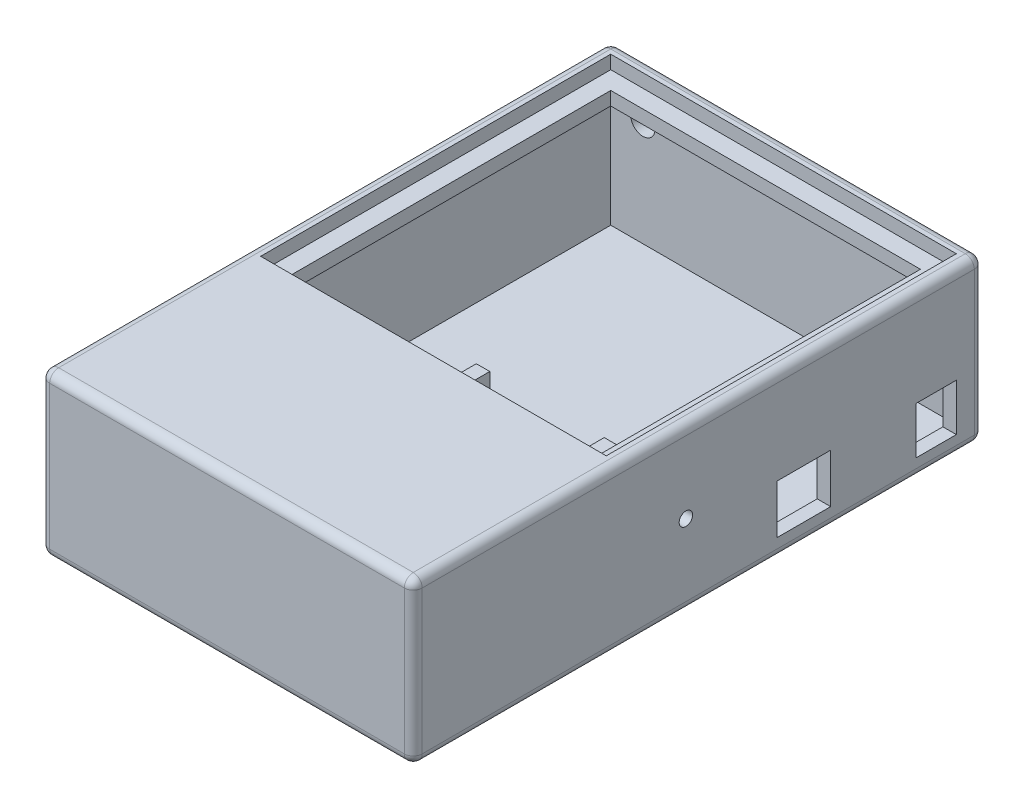
from build123d import *

# Parameters (mm, degrees)
SKETCH_1_W                = 83
SKETCH_1_H                = 127
EXTRUDE_1_DEPTH           = 36
SKETCH_2_W                = 77
SKETCH_2_H                = 40.7
CUT_EXTRUDE_1_DEPTH       = 22.9
SKETCH_3_W                = 77
SKETCH_3_H                = 78
CUT_EXTRUDE_4_DEPTH       = 33
SKETCH_4_W                = 31.5
SKETCH_4_H                = 25.3
EXTRUDE_2_DEPTH           = 11
SKETCH_5_W                = 25.5
SKETCH_5_H                = 23.3
CUT_EXTRUDE_5_DEPTH       = 11
CUT_EXTRUDE_6_DEPTH       = 14
CUT_EXTRUDE_6_DEPTH_BACK  = 10
SKETCH_6_R                = 1.5
SKETCH_7_R                = 2.5
CUT_EXTRUDE_7_DEPTH       = 22
CUT_EXTRUDE_8_DEPTH       = 23
CUT_EXTRUDE_8_DEPTH_BACK  = 30
SKETCH_8_R                = 2.7
CUT_EXTRUDE_9_DEPTH       = 11
CUT_EXTRUDE_9_DEPTH_BACK  = 33
SKETCH_9_W                = 12
SKETCH_9_H                = 10.9
CUT_EXTRUDE_10_DEPTH      = 14
CUT_EXTRUDE_10_DEPTH_BACK = 36
SKETCH_10_W               = 9
SKETCH_10_H               = 10.5
SKETCH_11_W               = 78
SKETCH_11_H               = 3
EXTRUDE_3_DEPTH           = 4
SKETCH_12_W               = 69
SKETCH_12_H               = 3
EXTRUDE_4_DEPTH           = 4
SKETCH_13_W               = 78
SKETCH_13_H               = 3
EXTRUDE_5_DEPTH           = 4
SKETCH_15_W               = 69
SKETCH_15_H               = 3
EXTRUDE_6_DEPTH           = 2
SKETCH_16_W               = 1.5
SKETCH_16_H               = 41.5
CUT_EXTRUDE_11_DEPTH      = 2
SKETCH_17_W               = 78.5
SKETCH_17_H               = 1.5
CUT_EXTRUDE_12_DEPTH      = 2
SKETCH_19_W               = 1.5
SKETCH_19_H               = 42.211102857
CUT_EXTRUDE_13_DEPTH      = 2
FILLET_1_R                = 2
FILLET_2_R                = 2
FILLET_3_R                = 2
FILLET_4_R                = 2
FILLET_5_R                = 2
SKETCH_20_W               = 8
SKETCH_20_H               = 10
CUT_EXTRUDE_14_DEPTH      = 2
SKETCH_21_W               = 8
SKETCH_21_H               = 10
CUT_EXTRUDE_15_DEPTH      = 2
CUT_EXTRUDE_16_DEPTH      = 102
CUT_EXTRUDE_16_DEPTH_BACK = 85
SKETCH_22_R               = 1.5
CUT_EXTRUDE_17_DEPTH      = 37
CUT_EXTRUDE_17_DEPTH_BACK = 68
SKETCH_23_R               = 1.5


with BuildPart() as part:
    # Эскиз1 → Бобышка-Вытянуть1 (new body)
    with BuildSketch(Plane(origin=(0, 0, 0), x_dir=(1, 0, 0), z_dir=(0, 1, 0))):
        with Locations((-41.5, 63.5)):
            Rectangle(SKETCH_1_W, SKETCH_1_H)
    extrude(amount=EXTRUDE_1_DEPTH)

    # Эскиз2 → Вырез-Вытянуть1 (cut)
    with BuildSketch(Plane(origin=(0, 0, 0), x_dir=(-1, 0, 0), z_dir=(0, -1, 0))):
        with Locations((41.5, 23.35)):
            Rectangle(SKETCH_2_W, SKETCH_2_H)
    extrude(amount=-CUT_EXTRUDE_1_DEPTH, mode=Mode.SUBTRACT)

    # Эскиз3 → Вырез-Вытянуть4 (cut)
    with BuildSketch(Plane(origin=(0, 36, 0), x_dir=(1, 0, 0), z_dir=(0, 1, 0))):
        with Locations((-41.5, 85)):
            Rectangle(SKETCH_3_W, SKETCH_3_H)
    extrude(amount=-CUT_EXTRUDE_4_DEPTH, mode=Mode.SUBTRACT)

    # Эскиз4 → Бобышка-Вытянуть2 (add)
    with BuildSketch(Plane(origin=(0, 3, 0), x_dir=(1, 0, 0), z_dir=(0, 1, 0))):
        with Locations((-41.5, 58.65)):
            Rectangle(SKETCH_4_W, SKETCH_4_H)
    extrude(amount=EXTRUDE_2_DEPTH)

    # Эскиз5 → Вырез-Вытянуть5 (cut)
    with BuildSketch(Plane(origin=(0, 14, 0), x_dir=(1, 0, 0), z_dir=(0, 1, 0))):
        with Locations((-41.5, 59.65)):
            Rectangle(SKETCH_5_W, SKETCH_5_H)
    extrude(amount=-CUT_EXTRUDE_5_DEPTH, mode=Mode.SUBTRACT)

    # Эскиз6 → Вырез-Вытянуть6 (cut, two sides: drawn at the far end of the back side and taken through both)
    with BuildSketch(Plane(origin=(0, 0, 0), x_dir=(0, 0, -1), z_dir=(1, 0, 0)).offset(-CUT_EXTRUDE_6_DEPTH_BACK)):
        with Locations(Location((60.742856383, 18, 0), (0, 0, 180))):
            Circle(SKETCH_6_R)
    extrude(amount=CUT_EXTRUDE_6_DEPTH + CUT_EXTRUDE_6_DEPTH_BACK, mode=Mode.SUBTRACT)

    # Эскиз7 → Вырез-Вытянуть7 (cut)
    with BuildSketch(Plane.XY.offset(-43.7)):
        with Locations((-5.5, 19.4)):
            Circle(SKETCH_7_R)
    extrude(amount=-CUT_EXTRUDE_7_DEPTH, mode=Mode.SUBTRACT)

    # Эскиз8 → Вырез-Вытянуть8 (cut, two sides: drawn at the far end of the back side and taken through both)
    with BuildSketch(Plane(origin=(0, 0, -127), x_dir=(-1, 0, 0), z_dir=(0, 0, -1)).offset(-CUT_EXTRUDE_8_DEPTH_BACK)):
        with Locations(Location((72.842031124, 26.425424665, 0), (0, 0, 180))):
            Circle(SKETCH_8_R)
    extrude(amount=CUT_EXTRUDE_8_DEPTH + CUT_EXTRUDE_8_DEPTH_BACK, mode=Mode.SUBTRACT)

    # Эскиз9 → Вырез-Вытянуть9 (cut, two sides: drawn at the far end of the back side and taken through both)
    with BuildSketch(Plane.ZY.offset(3).offset(-CUT_EXTRUDE_9_DEPTH_BACK)):
        with Locations((-87, 9.65)):
            Rectangle(SKETCH_9_W, SKETCH_9_H)
    extrude(amount=CUT_EXTRUDE_9_DEPTH + CUT_EXTRUDE_9_DEPTH_BACK, mode=Mode.SUBTRACT)

    # Эскиз10 → Вырез-Вытянуть10 (cut, two sides: drawn at the far end of the back side and taken through both)
    with BuildSketch(Plane.ZY.offset(3).offset(-CUT_EXTRUDE_10_DEPTH_BACK)):
        with Locations((-116.5, 9.35)):
            Rectangle(SKETCH_10_W, SKETCH_10_H)
    extrude(amount=CUT_EXTRUDE_10_DEPTH + CUT_EXTRUDE_10_DEPTH_BACK, mode=Mode.SUBTRACT)

    # Эскиз11 → Бобышка-Вытянуть3 (add)
    with BuildSketch(Plane.ZY.offset(3)):
        with Locations((-85, 31.5)):
            Rectangle(SKETCH_11_W, SKETCH_11_H)
    extrude(amount=EXTRUDE_3_DEPTH)

    # Эскиз12 → Бобышка-Вытянуть4 (add)
    with BuildSketch(Plane.XY.offset(-124)):
        with Locations((-41.5, 31.5)):
            Rectangle(SKETCH_12_W, SKETCH_12_H)
    extrude(amount=EXTRUDE_4_DEPTH)

    # Эскиз13 → Бобышка-Вытянуть5 (add)
    with BuildSketch(Plane(origin=(-80, 0, 0), x_dir=(0, 0, -1), z_dir=(1, 0, 0))):
        with Locations((85, 31.5)):
            Rectangle(SKETCH_13_W, SKETCH_13_H)
    extrude(amount=EXTRUDE_5_DEPTH)

    # Эскиз15 → Бобышка-Вытянуть6 (add)
    with BuildSketch(Plane(origin=(0, 0, -46), x_dir=(-1, 0, 0), z_dir=(0, 0, -1))):
        with Locations((41.5, 31.5)):
            Rectangle(SKETCH_15_W, SKETCH_15_H)
    extrude(amount=EXTRUDE_6_DEPTH)

    # Эскиз16 → Вырез-Вытянуть11 (cut)
    with BuildSketch(Plane(origin=(0, 0, 0), x_dir=(-1, 0, 0), z_dir=(0, -1, 0))):
        with Locations((2.25, 23.75)):
            Rectangle(SKETCH_16_W, SKETCH_16_H)
    extrude(amount=-CUT_EXTRUDE_11_DEPTH, mode=Mode.SUBTRACT)

    # Эскиз17 → Вырез-Вытянуть12 (cut)
    with BuildSketch(Plane.XZ):
        with Locations((-40.75, -44.45)):
            Rectangle(SKETCH_17_W, SKETCH_17_H)
    extrude(amount=-CUT_EXTRUDE_12_DEPTH, mode=Mode.SUBTRACT)

    # Эскиз19 → Вырез-Вытянуть13 (cut)
    with BuildSketch(Plane.XZ):
        with Locations((-80.75, -24.094448572)):
            Rectangle(SKETCH_19_W, SKETCH_19_H)
    extrude(amount=-CUT_EXTRUDE_13_DEPTH, mode=Mode.SUBTRACT)

    # Скругление1
    fillet_1_edges = [part.edges().sort_by_distance(p)[0] for p in [
        (-41.5, 36, -127),
    ]]
    fillet(fillet_1_edges, radius=FILLET_1_R)

    # Скругление2
    fillet_2_edges = [part.edges().sort_by_distance(p)[0] for p in [
        (-83, 36, -62.5),
        (-83, 17, -127),
        (-83, 35.414213562, -126.414213562),
    ]]
    fillet(fillet_2_edges, radius=FILLET_2_R)

    # Скругление3
    fillet_3_edges = [part.edges().sort_by_distance(p)[0] for p in [
        (-83, 17, 0),
        (-40.5, 36, 0),
        (-82.414213562, 35.414213562, 0),
    ]]
    fillet(fillet_3_edges, radius=FILLET_3_R)

    # Скругление4
    fillet_4_edges = [part.edges().sort_by_distance(p)[0] for p in [
        (0, 17, -127),
        (0, 35.414213562, -126.414213562),
        (0, 17, 0),
        (0, 36, -63.5),
        (0, 35.414213562, -0.585786438),
    ]]
    fillet(fillet_4_edges, radius=FILLET_4_R)

    # Скругление5
    # the kernel refuses this fillet: 2 mm, written as the material it takes off along each edge
    with BuildSketch(Plane(origin=(-2, 0, -125), x_dir=(1, 0, 0), z_dir=(0, 0, 1))) as fillet_5_piece_1:
        with BuildLine():
            CenterArc((2 - FILLET_5_R, FILLET_5_R), FILLET_5_R, 270, 90)
            Line((2, FILLET_5_R), (2, 0))
            Line((2, 0), (2 - FILLET_5_R, 0))
        make_face()
    revolve(axis=Axis((-2, 0, -125), (0, 1, 0)), revolution_arc=90, mode=Mode.SUBTRACT)
    with BuildSketch(Plane(origin=(0, 0, -125), x_dir=(0, 1, 0), z_dir=(0, 0, 1))) as fillet_5_piece_2:
        with BuildLine():
            CenterArc((FILLET_5_R, FILLET_5_R), FILLET_5_R, 180, 90)
            Line((0, FILLET_5_R), (0, 0))
            Line((0, 0), (FILLET_5_R, 0))
        make_face()
    extrude(amount=123, mode=Mode.SUBTRACT)
    with BuildSketch(Plane(origin=(-2, 0, -2), x_dir=(1, 0, 0), z_dir=(0, 0, -1))) as fillet_5_piece_3:
        with BuildLine():
            CenterArc((2 - FILLET_5_R, -FILLET_5_R), FILLET_5_R, 0, 90)
            Line((2, -FILLET_5_R), (2, 0))
            Line((2, 0), (2 - FILLET_5_R, 0))
        make_face()
    revolve(axis=Axis((-2, 0, -2), (0, -1, 0)), revolution_arc=90, mode=Mode.SUBTRACT)
    with BuildSketch(Plane(origin=(-2, 0, 0), x_dir=(0, 0, -1), z_dir=(-1, 0, 0)), Plane(origin=(-81, 0, -127), x_dir=(0, 0, 1), z_dir=(1, 0, 0))) as fillet_5_piece_4:
        with BuildLine():
            CenterArc((FILLET_5_R, -FILLET_5_R), FILLET_5_R, 90, 90)
            Line((0, -FILLET_5_R), (0, 0))
            Line((0, 0), (FILLET_5_R, 0))
        make_face()
    extrude(amount=79, mode=Mode.SUBTRACT)
    with BuildSketch(Plane(origin=(-81, 0, -2), x_dir=(-1, 0, 0), z_dir=(0, 0, -1))) as fillet_5_piece_5:
        with BuildLine():
            CenterArc((2 - FILLET_5_R, FILLET_5_R), FILLET_5_R, 270, 90)
            Line((2, FILLET_5_R), (2, 0))
            Line((2, 0), (2 - FILLET_5_R, 0))
        make_face()
    revolve(axis=Axis((-81, 0, -2), (0, 1, 0)), revolution_arc=90, mode=Mode.SUBTRACT)
    with BuildSketch(Plane(origin=(-83, 0, -2), x_dir=(1, 0, 0), z_dir=(0, 0, -1))) as fillet_5_piece_6:
        with BuildLine():
            CenterArc((FILLET_5_R, -FILLET_5_R), FILLET_5_R, 90, 90)
            Line((0, -FILLET_5_R), (0, 0))
            Line((0, 0), (FILLET_5_R, 0))
        make_face()
    extrude(amount=123, mode=Mode.SUBTRACT)
    with BuildSketch(Plane(origin=(-81, 0, -125), x_dir=(-1, 0, 0), z_dir=(0, 0, 1))) as fillet_5_piece_7:
        with BuildLine():
            CenterArc((2 - FILLET_5_R, -FILLET_5_R), FILLET_5_R, 0, 90)
            Line((2, -FILLET_5_R), (2, 0))
            Line((2, 0), (2 - FILLET_5_R, 0))
        make_face()
    revolve(axis=Axis((-81, 0, -125), (0, -1, 0)), revolution_arc=90, mode=Mode.SUBTRACT)

    # Эскиз20 → Вырез-Вытянуть14 (cut)
    with BuildSketch(Plane.XZ):
        with Locations((-15, -50.2)):
            Rectangle(SKETCH_20_W, SKETCH_20_H)
    extrude(amount=-CUT_EXTRUDE_14_DEPTH, mode=Mode.SUBTRACT)

    # Эскиз21 → Вырез-Вытянуть15 (cut)
    with BuildSketch(Plane.XZ):
        with Locations((-68, -50.2)):
            Rectangle(SKETCH_21_W, SKETCH_21_H)
    extrude(amount=-CUT_EXTRUDE_15_DEPTH, mode=Mode.SUBTRACT)

    # Эскиз22 → Вырез-Вытянуть16 (cut, two sides: drawn at the far end of the back side and taken through both)
    with BuildSketch(Plane.XZ.offset(-2).offset(-CUT_EXTRUDE_16_DEPTH_BACK)):
        with Locations(Location((-15, -51.2, 0), (0, 0, 270))):
            Circle(SKETCH_22_R)
    extrude(amount=CUT_EXTRUDE_16_DEPTH + CUT_EXTRUDE_16_DEPTH_BACK, mode=Mode.SUBTRACT)

    # Эскиз23 → Вырез-Вытянуть17 (cut, two sides: drawn at the far end of the back side and taken through both)
    with BuildSketch(Plane.XZ.offset(-2).offset(-CUT_EXTRUDE_17_DEPTH_BACK)):
        with Locations(Location((-68, -51.2, 0), (0, 0, 90))):
            Circle(SKETCH_23_R)
    extrude(amount=CUT_EXTRUDE_17_DEPTH + CUT_EXTRUDE_17_DEPTH_BACK, mode=Mode.SUBTRACT)


solid = part.part
